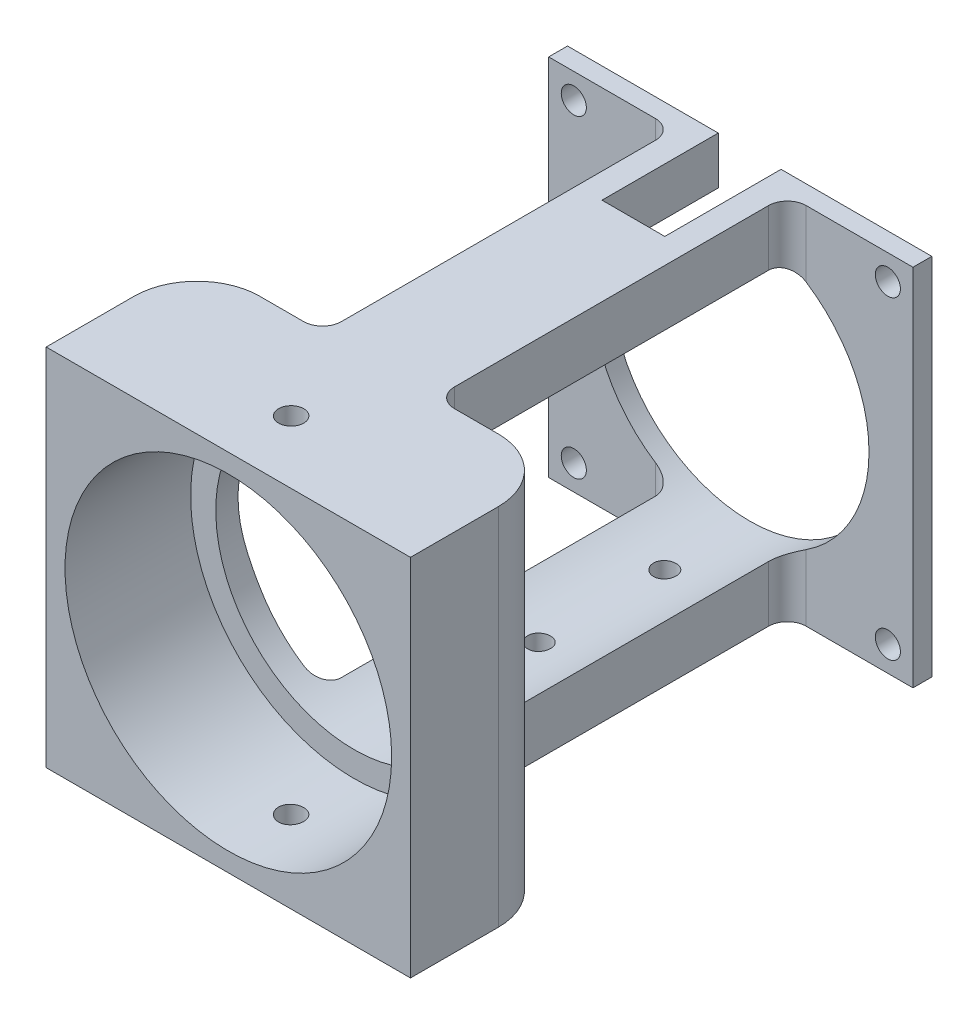
from build123d import *

# Parameters (mm, degrees)
SKETCH_1_R               = 2
EXTRUDE_1_DEPTH          = 58
SKETCH_2_R               = 22
CUT_EXTRUDE_1_DEPTH      = 89
SKETCH_3_R               = 26
CUT_EXTRUDE_2_DEPTH      = 20
FILLET_1_R               = 3
SKETCH_4_R               = 2
CUT_EXTRUDE_3_DEPTH      = 20
SKETCH_5_R               = 1.8
CUT_EXTRUDE_4_DEPTH      = 20
CUT_EXTRUDE_5_DEPTH      = 5
CUT_EXTRUDE_5_DEPTH_BACK = 5
SKETCH_6_R               = 43.5


with BuildPart() as part:
    # 草图1 → 凸台-拉伸1 (new body)
    with BuildSketch(Plane(origin=(0, 0, 0), x_dir=(1, 0, 0), z_dir=(0, 1, 0))):
        with BuildLine():
            Line((-29, 38.5), (-9, 38.5))
            Line((-9, 38.5), (-9, -17.5))
            Line((-9, -17.5), (-19, -17.5))
            ThreePointArc((-19, -17.5), (-26.071067812, -20.428932188), (-29, -27.5))
            Line((-29, -27.5), (-29, -41.5))
            Line((-29, -41.5), (29, -41.5))
            Line((29, -41.5), (29, -27.5))
            ThreePointArc((29, -27.5), (26.071067812, -20.428932188), (19, -17.5))
            Line((19, -17.5), (9, -17.5))
            Line((9, -17.5), (9, 38.5))
            Line((9, 38.5), (29, 38.5))
            Line((29, 38.5), (29, 41.5))
            Line((29, 41.5), (-29, 41.5))
            Line((-29, 41.5), (-29, 38.5))
        make_face()
        with Locations((0, -31.5)):
            Circle(SKETCH_1_R, mode=Mode.SUBTRACT)
    extrude(amount=EXTRUDE_1_DEPTH)

    # 草图2 → 切除-拉伸1 (cut)
    with BuildSketch(Plane(origin=(0, 0, -41.5), x_dir=(-1, 0, 0), z_dir=(0, 0, -1))):
        with Locations((0, 29)):
            Circle(SKETCH_2_R)
    extrude(amount=-CUT_EXTRUDE_1_DEPTH, mode=Mode.SUBTRACT)

    # 草图3 → 切除-拉伸2 (cut)
    with BuildSketch(Plane.XY.offset(41.5)):
        with Locations((0, 29)):
            Circle(SKETCH_3_R)
    extrude(amount=-CUT_EXTRUDE_2_DEPTH, mode=Mode.SUBTRACT)

    # 圆角1
    fillet_1_edges = [part.edges().sort_by_distance(p)[0] for p in [
        (-9, 4.46257005, 17.5),
        (-9, 53.53742995, 17.5),
        (-9, 4.46257005, -38.5),
        (-9, 53.53742995, -38.5),
        (9, 4.46257005, 17.5),
        (9, 53.53742995, 17.5),
        (9, 4.46257005, -38.5),
        (9, 53.53742995, -38.5),
    ]]
    fillet(fillet_1_edges, radius=FILLET_1_R)

    # 草图4 → 切除-拉伸3 (cut)
    with BuildSketch(Plane(origin=(0, 0, -41.5), x_dir=(-1, 0, 0), z_dir=(0, 0, -1))):
        with Locations((-25, 54)):
            Circle(SKETCH_4_R)
        with Locations((25, 54)):
            Circle(SKETCH_4_R)
        with Locations((25, 4)):
            Circle(SKETCH_4_R)
        with Locations((-25, 4)):
            Circle(SKETCH_4_R)
    extrude(amount=-CUT_EXTRUDE_3_DEPTH, mode=Mode.SUBTRACT)

    # 草图5 → 切除-拉伸4 (cut)
    with BuildSketch(Plane.XZ):
        with Locations((0, 12)):
            Circle(SKETCH_5_R)
        with Locations((0, -8)):
            Circle(SKETCH_5_R)
        with Locations((0, -28)):
            Circle(SKETCH_5_R)
    extrude(amount=-CUT_EXTRUDE_4_DEPTH, mode=Mode.SUBTRACT)

    # 草图6 → 切除-拉伸5 (cut, two sides: drawn at the far end of the back side and taken through both)
    with BuildSketch(Plane(origin=(0, 0, 0), x_dir=(0, 0, -1), z_dir=(1, 0, 0)).offset(-CUT_EXTRUDE_5_DEPTH_BACK)):
        with Locations((64.5, 71)):
            Circle(SKETCH_6_R)
    extrude(amount=CUT_EXTRUDE_5_DEPTH + CUT_EXTRUDE_5_DEPTH_BACK, mode=Mode.SUBTRACT)


solid = part.part
